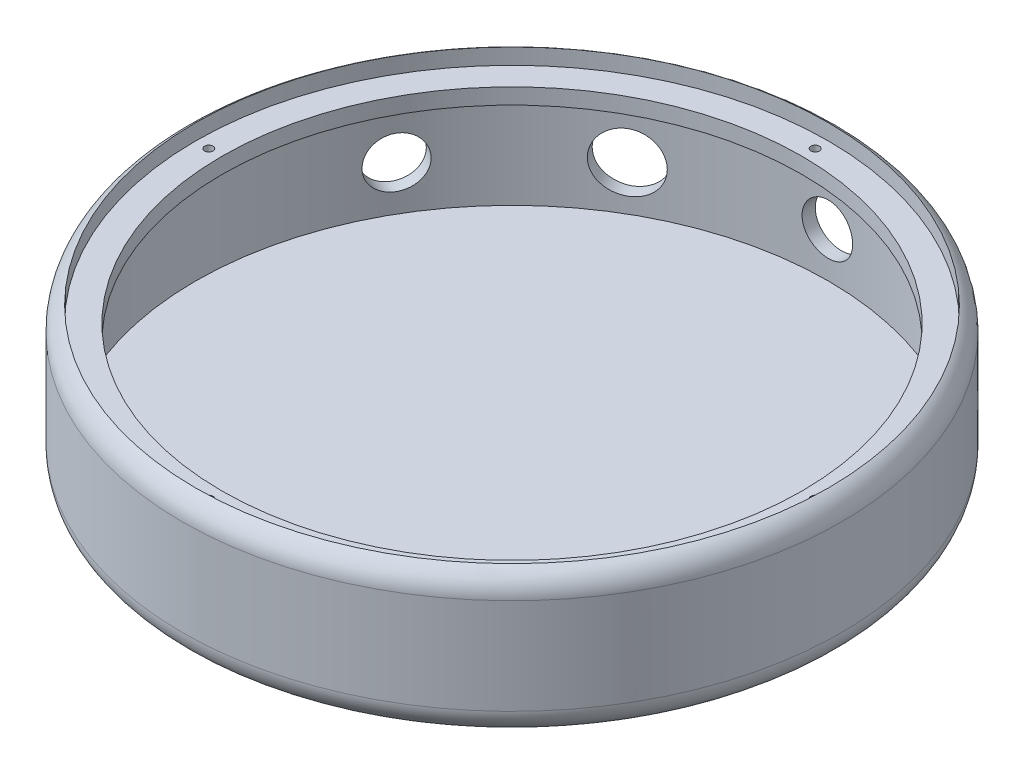
from build123d import *

# Parameters (mm, degrees)
SKETCH_21_R         = 125
EXTRUDE_1_DEPTH     = 55
SKETCH_22_R         = 120
CUT_EXTRUDE_1_DEPTH = 52
SKETCH_23_R         = 120
SKETCH_23_R_2       = 110
EXTRUDE_2_DEPTH     = 12
SKETCH_24_R         = 120
SKETCH_24_R_2       = 110
CUT_EXTRUDE_2_DEPTH = 6
SKETCH_25_R         = 1.6
CUT_EXTRUDE_3_DEPTH = 10
FILLET_1_R          = 10
FILLET_2_R          = 10
SKETCH_26_R         = 9.6
CUT_EXTRUDE_4_DEPTH = 1202
SKETCH_28_R         = 11.1
CUT_EXTRUDE_5_DEPTH = 1202
SKETCH_30_R         = 6.025
CUT_EXTRUDE_6_DEPTH = 1202
SKETCH_31_R         = 9.6
CUT_EXTRUDE_7_DEPTH = 1000


with BuildPart() as part:
    # 草图21 → 凸台-拉伸1 (new body)
    with BuildSketch(Plane(origin=(0, 0, 0), x_dir=(1, 0, 0), z_dir=(0, 1, 0))):
        with Locations(Location((0, 0, 0), (0, 0, 270))):
            Circle(SKETCH_21_R)
    extrude(amount=EXTRUDE_1_DEPTH)

    # 草图22 → 切除-拉伸1 (cut)
    with BuildSketch(Plane(origin=(0, 55, 0), x_dir=(1, 0, 0), z_dir=(0, 1, 0))):
        with Locations(Location((0, 0, 0), (0, 0, 270))):
            Circle(SKETCH_22_R)
    extrude(amount=-CUT_EXTRUDE_1_DEPTH, mode=Mode.SUBTRACT)

    # 草图23 → 凸台-拉伸2 (add)
    with BuildSketch(Plane(origin=(0, 55, 0), x_dir=(1, 0, 0), z_dir=(0, 1, 0))):
        with Locations(Location((0, 0, 0), (0, 0, 270))):
            Circle(SKETCH_23_R)
        with Locations(Location((0, 0, 0), (0, 0, 270))):
            Circle(SKETCH_23_R_2, mode=Mode.SUBTRACT)
    extrude(amount=-EXTRUDE_2_DEPTH)

    # 草图24 → 切除-拉伸2 (cut)
    with BuildSketch(Plane(origin=(0, 55, 0), x_dir=(1, 0, 0), z_dir=(0, 1, 0))):
        with Locations(Location((0, 0, 0), (0, 0, 270))):
            Circle(SKETCH_24_R)
        with Locations(Location((0, 0, 0), (0, 0, 270))):
            Circle(SKETCH_24_R_2, mode=Mode.SUBTRACT)
    extrude(amount=-CUT_EXTRUDE_2_DEPTH, mode=Mode.SUBTRACT)

    # 草图25 → 切除-拉伸3 (cut)
    with BuildSketch(Plane(origin=(0, 49, 0), x_dir=(1, 0, 0), z_dir=(0, 1, 0))):
        with Locations(Location((0, 115, 0), (0, 0, 270))):
            Circle(SKETCH_25_R)
        with Locations(Location((115, 0, 0), (0, 0, 270))):
            Circle(SKETCH_25_R)
        with Locations(Location((0, -115, 0), (0, 0, 270))):
            Circle(SKETCH_25_R)
        with Locations(Location((-115, 0, 0), (0, 0, 270))):
            Circle(SKETCH_25_R)
    extrude(amount=-CUT_EXTRUDE_3_DEPTH, mode=Mode.SUBTRACT)

    # 圆角1
    fillet_1_edges = [part.edges().sort_by_distance(p)[0] for p in [
        (0, 0, -125),
    ]]
    fillet(fillet_1_edges, radius=FILLET_1_R)

    # 圆角2
    # the kernel refuses this fillet: 10 mm, written as the material it takes off along each edge
    with BuildSketch(Plane(origin=(0, 55, 0), x_dir=(0, 0, 1), z_dir=(-1, 0, 0))) as fillet_2_piece_1:
        with BuildLine():
            CenterArc((115, -8.660254038), FILLET_2_R, 0, 60)
            Line((120, 0), (120.1, 0.173205081))
            ThreePointArc((120.1, 0.173205081), (122.5, 0.2), (125, 0.2))
            Line((125, 0.2), (125.2, 0))
            Line((125.2, 0), (125.2, -8.660254038))
            Line((125.2, -8.660254038), (125, -8.660254038))
        make_face()
    revolve(axis=Axis((0, 55, 0), (0, 1, 0)), mode=Mode.SUBTRACT)

    # 草图26 → 切除-拉伸4 (cut)
    with BuildSketch(Plane.XY):
        with Locations((0, 20)):
            Circle(SKETCH_26_R)
    extrude(amount=-CUT_EXTRUDE_4_DEPTH, mode=Mode.SUBTRACT)

    # 草图28 → 切除-拉伸5 (cut)
    with BuildSketch(Plane(origin=(0, 0, 0), x_dir=(0, 1, 0), z_dir=(0.500000000000001, 0, 0.866025403784438))):
        with Locations(Location((20, 0, 0), (0, 0, 270))):
            Circle(SKETCH_28_R)
    extrude(amount=-CUT_EXTRUDE_5_DEPTH, mode=Mode.SUBTRACT)

    # 草图30 → 切除-拉伸6 (cut)
    with BuildSketch(Plane(origin=(0, 0, 0), x_dir=(0, 1, 0), z_dir=(-0.4999999999999889, 0, 0.866025403784445))):
        with Locations(Location((15, 0, 0), (0, 0, 270))):
            Circle(SKETCH_30_R)
    extrude(amount=-CUT_EXTRUDE_6_DEPTH, mode=Mode.SUBTRACT)

    # 草图31 → 切除-拉伸7 (cut)
    with BuildSketch(Plane(origin=(0, 0, 0), x_dir=(0, 1, 0), z_dir=(0.8660254037844398, 0, 0.499999999999998))):
        with Locations(Location((20, 0, 0), (0, 0, 270))):
            Circle(SKETCH_31_R)
    extrude(amount=-CUT_EXTRUDE_7_DEPTH, mode=Mode.SUBTRACT)


solid = part.part
